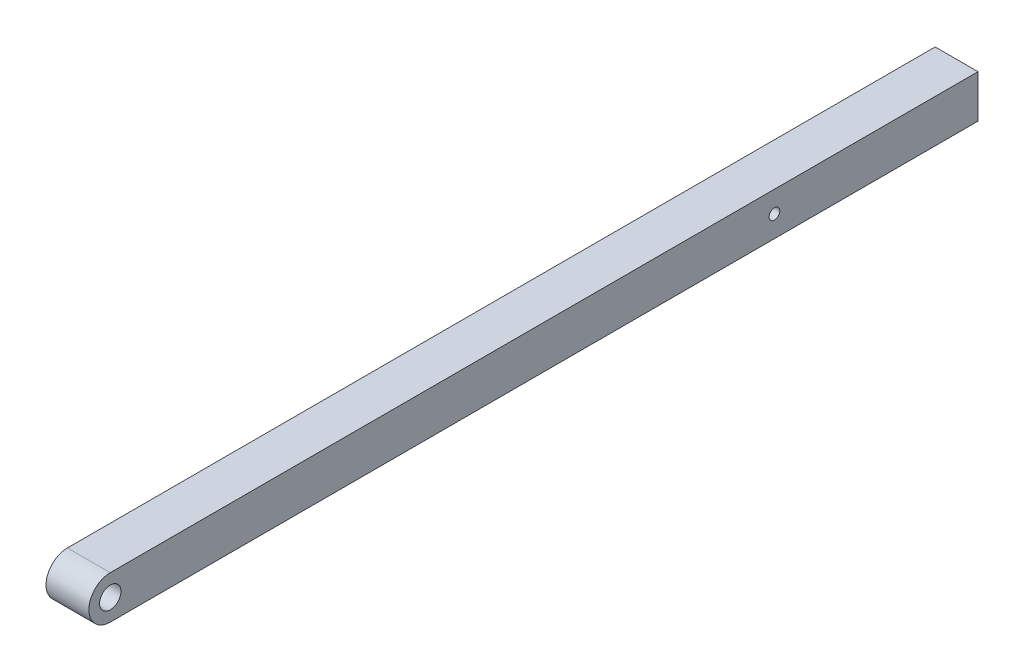
from build123d import *

# Parameters (mm, degrees)
SKETCH1_R                   = 6.35
BOSS_EXTRUDE1_DEPTH         = 25.4
F_1_4_20_TAPPED_HOLE1_D     = 5.1054
F_1_4_20_TAPPED_HOLE1_DEPTH = 16.51
F_1_4_20_TAPPED_HOLE1_TIP   = 1.533816902
SKETCH4_R                   = 3.175
CUT_EXTRUDE1_DEPTH          = 38.1


with BuildPart() as part:
    # Sketch1 → Boss-Extrude1 (new body)
    with BuildSketch(Plane(origin=(0, 0, 0), x_dir=(0, 0, -1), z_dir=(1, 0, 0))):
        with BuildLine():
            Line((0, 12.7), (514.35, 12.7))
            Line((514.35, 12.7), (514.35, -12.7))
            Line((514.35, -12.7), (0, -12.7))
            ThreePointArc((0, -12.7), (-12.7, 0), (0, 12.7))
        make_face()
        Circle(SKETCH1_R, mode=Mode.SUBTRACT)
    extrude(amount=BOSS_EXTRUDE1_DEPTH)

    # 1/4-20 Tapped Hole1
    with Locations(Plane(origin=(0, 0, -514.35), x_dir=(-1, 0, 0), z_dir=(0, 0, -1))):
        with Locations((-6.35, 0), (-19.05, 0)):
            Hole(F_1_4_20_TAPPED_HOLE1_D / 2, depth=F_1_4_20_TAPPED_HOLE1_DEPTH)
            with Locations((0, 0, -(F_1_4_20_TAPPED_HOLE1_DEPTH + F_1_4_20_TAPPED_HOLE1_TIP / 2))):  # 118° drill point
                Cone(0, F_1_4_20_TAPPED_HOLE1_D / 2, F_1_4_20_TAPPED_HOLE1_TIP, mode=Mode.SUBTRACT)

    # Sketch4 → Cut-Extrude1 (cut)
    with BuildSketch(Plane(origin=(25.4, 0, 0), x_dir=(0, 0, -1), z_dir=(1, 0, 0))):
        with Locations((393.7, 0)):
            Circle(SKETCH4_R)
    extrude(amount=-CUT_EXTRUDE1_DEPTH, mode=Mode.SUBTRACT)


solid = part.part
